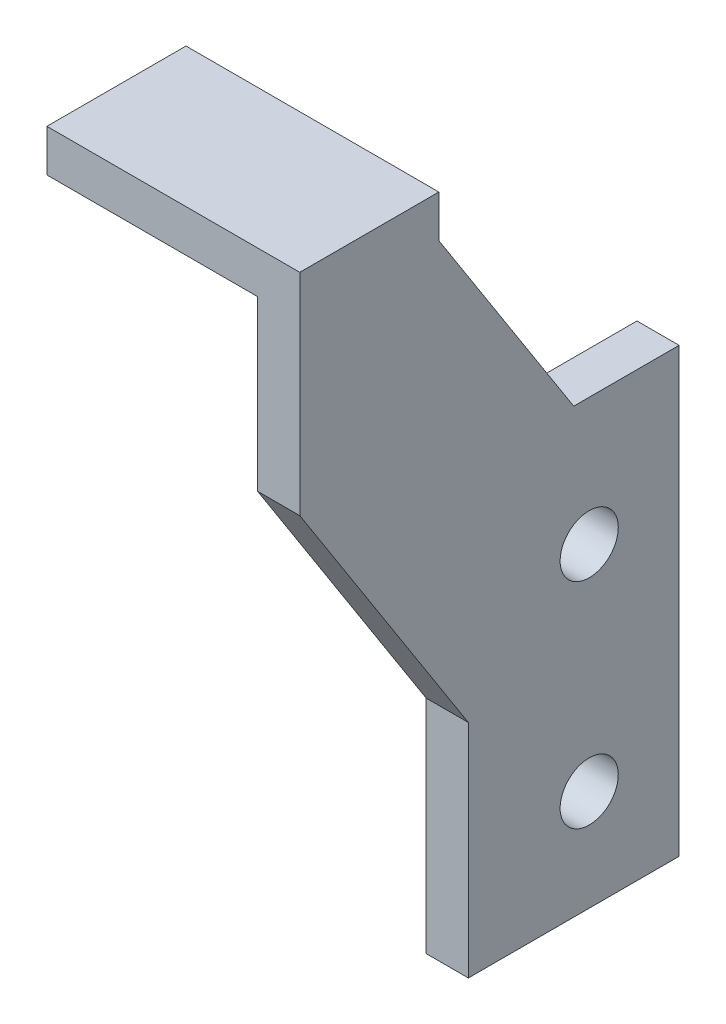
from build123d import *

# Parameters (mm, degrees)
SKETCH1_R           = 3.45
BOSS_EXTRUDE1_DEPTH = 5
SKETCH2_W           = 30
SKETCH2_H           = 5
EXTRUDE_THIN1_DEPTH = 16.5


with BuildPart() as part:
    # Sketch1 → Boss-Extrude1 (new body)
    with BuildSketch(Plane.ZY.offset(334.046148356)):
        Polygon((-716.796907189, -260.167788698), (-700.296907189, -260.167788698), (-700.296907189, -280.167788698), (-720.296907189, -311.417788698), (-720.296907189, -337.667788698), (-745.296907189, -337.667788698), (-745.296907189, -285.167788698), (-732.796907189, -285.167788698), align=None)
        with Locations((-734.631542685, -325.667788698)):
            Circle(SKETCH1_R, mode=Mode.SUBTRACT)
        with Locations((-734.631542685, -300.267788698)):
            Circle(SKETCH1_R, mode=Mode.SUBTRACT)
    extrude(amount=BOSS_EXTRUDE1_DEPTH)

    # Sketch2 → Extrude-Thin1 (add)
    with BuildSketch(Plane.XY.offset(-700.296907189)):
        with Locations((-349.046148356, -257.667788698)):
            Rectangle(SKETCH2_W, SKETCH2_H)
    extrude(amount=-EXTRUDE_THIN1_DEPTH)


solid = part.part
